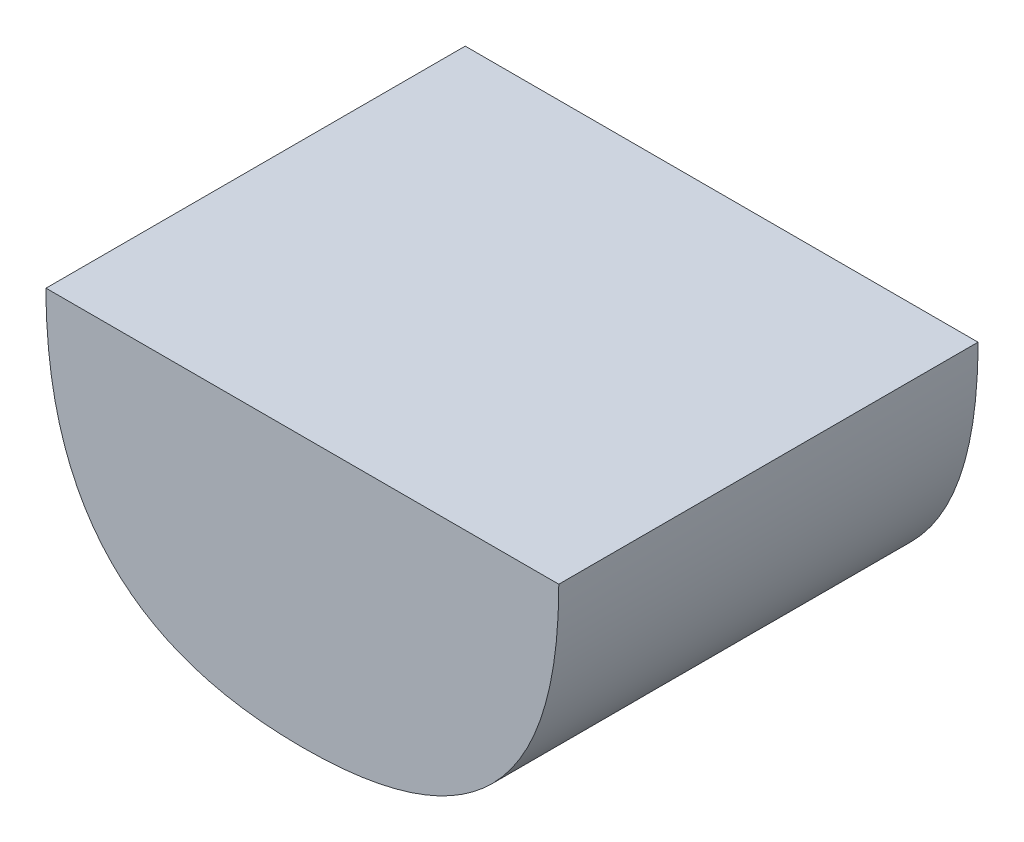
from build123d import *

# Parameters (mm, degrees)
BOSS_EXTRUDE1_DEPTH = 494.3856


with BuildPart() as part:
    # Sketch1 → Boss-Extrude1 (new body)
    with BuildSketch(Plane.XY):
        with BuildLine():
            Line((-302.357037841, 317.813001305), (302.357037841, 317.813001305))
            add(Edge.make_bspline(
                [(0, 0), (302.357037841, -0.066445002), (302.357037841, 317.813001305)],
                knots=[0, 0, 0, 1, 1, 1], degree=2, weights=[1, 1.019369595, 1]))
            add(Edge.make_bspline(
                [(0, 0), (-302.357037841, -0.066445002), (-302.357037841, 317.813001305)],
                knots=[0, 0, 0, 1, 1, 1], degree=2, weights=[1, 1.019369595, 1]))
        make_face()
    extrude(amount=-BOSS_EXTRUDE1_DEPTH)


solid = part.part
